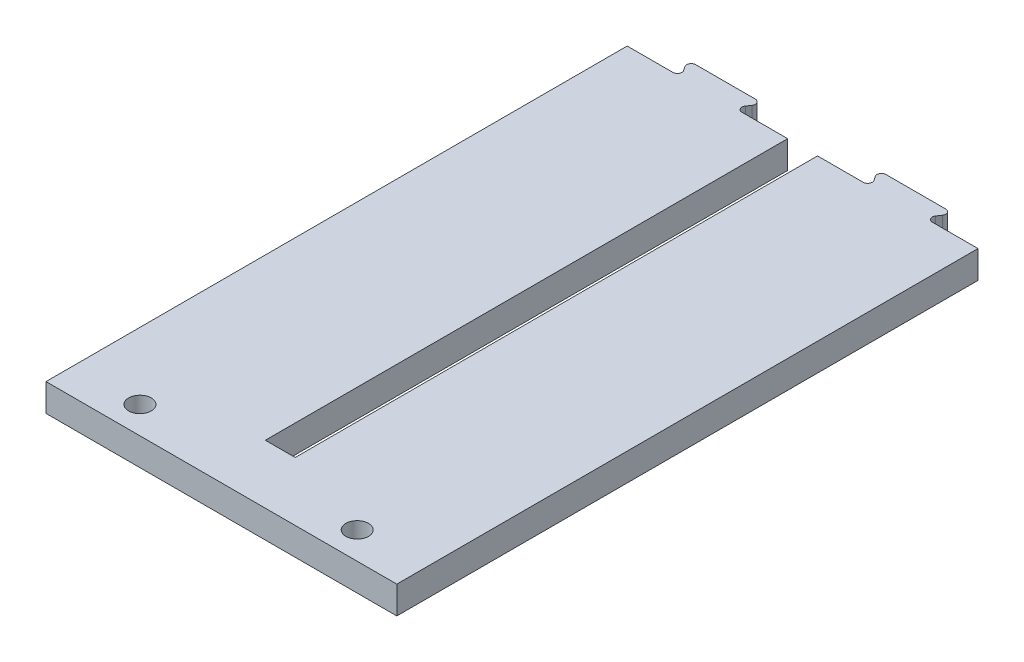
from build123d import *

# Parameters (mm, degrees)
SKETCH1_W                   = 38.75
SKETCH1_H                   = 72.5
BOSS_EXTRUDE1_DEPTH         = 3.05
SKETCH4_W                   = 3.3
SKETCH4_H                   = 1
SKETCH4_H_2                 = 61.8
CUT_EXTRUDE1_DEPTH          = 76.106212293
SKETCH8_W                   = 38.75
SKETCH8_H                   = 8.3
CUT_EXTRUDE5_DEPTH          = 76.106212293
BOSS_EXTRUDE3_DEPTH         = 3.05
FILLET2_R                   = 0.5
TAP_DRILL_FOR_M3X0_5_TAP1_D = 2.5


with BuildPart() as part:
    # Sketch1 → Boss-Extrude1 (new body)
    with BuildSketch(Plane(origin=(0, 0, 0), x_dir=(1, 0, 0), z_dir=(0, 1, 0))):
        with Locations((0, 36.25)):
            Rectangle(SKETCH1_W, SKETCH1_H)
    extrude(amount=BOSS_EXTRUDE1_DEPTH)

    # Sketch4 → Cut-Extrude1 (cut, through all)
    with BuildSketch(Plane(origin=(0, 3.05, 0), x_dir=(1, 0, 0), z_dir=(0, 1, 0))):
        with Locations((0, 70)):
            Rectangle(SKETCH4_W, SKETCH4_H)
        with Locations((0, 37.4)):
            Rectangle(SKETCH4_W, SKETCH4_H_2)
    extrude(amount=-CUT_EXTRUDE1_DEPTH, mode=Mode.SUBTRACT)

    # Sketch8 → Cut-Extrude5 (cut, through all)
    with BuildSketch(Plane(origin=(0, 3.05, 0), x_dir=(1, 0, 0), z_dir=(0, 1, 0))):
        with Locations((0, 68.35)):
            Rectangle(SKETCH8_W, SKETCH8_H)
    extrude(amount=-CUT_EXTRUDE5_DEPTH, mode=Mode.SUBTRACT)

    # Sketch9 → Boss-Extrude3 (add)
    with BuildSketch(Plane(origin=(0, 3.05, 0), x_dir=(1, 0, 0), z_dir=(0, 1, 0))):
        Polygon((-14.7625, 66.2), (-13.375, 64.2), (-7.65, 64.2), (-6.2625, 66.2), align=None)
        Polygon((6.2625, 66.2), (7.65, 64.2), (13.375, 64.2), (14.7625, 66.2), align=None)
    extrude(amount=-BOSS_EXTRUDE3_DEPTH)

    # Fillet2
    fillet2_edges = [part.edges().sort_by_distance(p)[0] for p in [
        (13.375, 1.525, -64.2),
        (-7.65, 1.525, -64.2),
        (14.7625, 1.525, -66.2),
        (7.65, 1.525, -64.2),
        (6.2625, 1.525, -66.2),
        (-6.2625, 1.525, -66.2),
        (-14.7625, 1.525, -66.2),
        (-13.375, 1.525, -64.2),
    ]]
    fillet(fillet2_edges, radius=FILLET2_R)

    # Tap Drill for M3x0.5 Tap1 (through all)
    with Locations(Plane(origin=(0, 3.05, 0), x_dir=(1, 0, 0), z_dir=(0, 1, 0))):
        with Locations((-12, 3), (12, 3)):
            Hole(TAP_DRILL_FOR_M3X0_5_TAP1_D / 2)


solid = part.part
